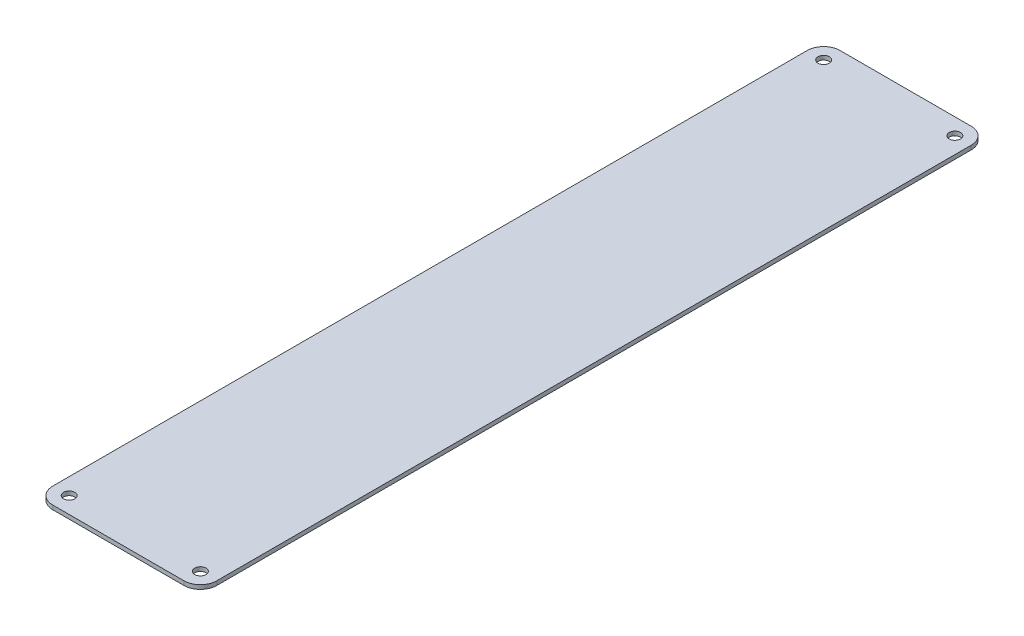
from build123d import *

# Parameters (mm, degrees)
SKETCH1_R           = 2.1828125
BOSS_EXTRUDE1_DEPTH = 0.79375


with BuildPart() as part:
    # Sketch1 → Boss-Extrude1 (new, symmetric)
    with BuildSketch(Plane(origin=(0, 0, 0), x_dir=(1, 0, 0), z_dir=(0, 1, 0))):
        with BuildLine():
            Line((6.35, 0), (57.15, 0))
            ThreePointArc((57.15, 0), (61.640128061, 1.859871939), (63.5, 6.35))
            Line((63.5, 6.35), (63.5, 298.45))
            ThreePointArc((63.5, 298.45), (61.640128061, 302.940128061), (57.15, 304.8))
            Line((57.15, 304.8), (6.35, 304.8))
            ThreePointArc((6.35, 304.8), (1.859871939, 302.940128061), (0, 298.45))
            Line((0, 298.45), (0, 6.35))
            ThreePointArc((0, 6.35), (1.859871939, 1.859871939), (6.35, 0))
        make_face()
        with Locations((57.15, 298.45)):
            Circle(SKETCH1_R, mode=Mode.SUBTRACT)
        with Locations((6.35, 298.45)):
            Circle(SKETCH1_R, mode=Mode.SUBTRACT)
        with Locations((6.35, 6.35)):
            Circle(SKETCH1_R, mode=Mode.SUBTRACT)
        with Locations((57.15, 6.35)):
            Circle(SKETCH1_R, mode=Mode.SUBTRACT)
    extrude(amount=BOSS_EXTRUDE1_DEPTH, both=True)


solid = part.part
